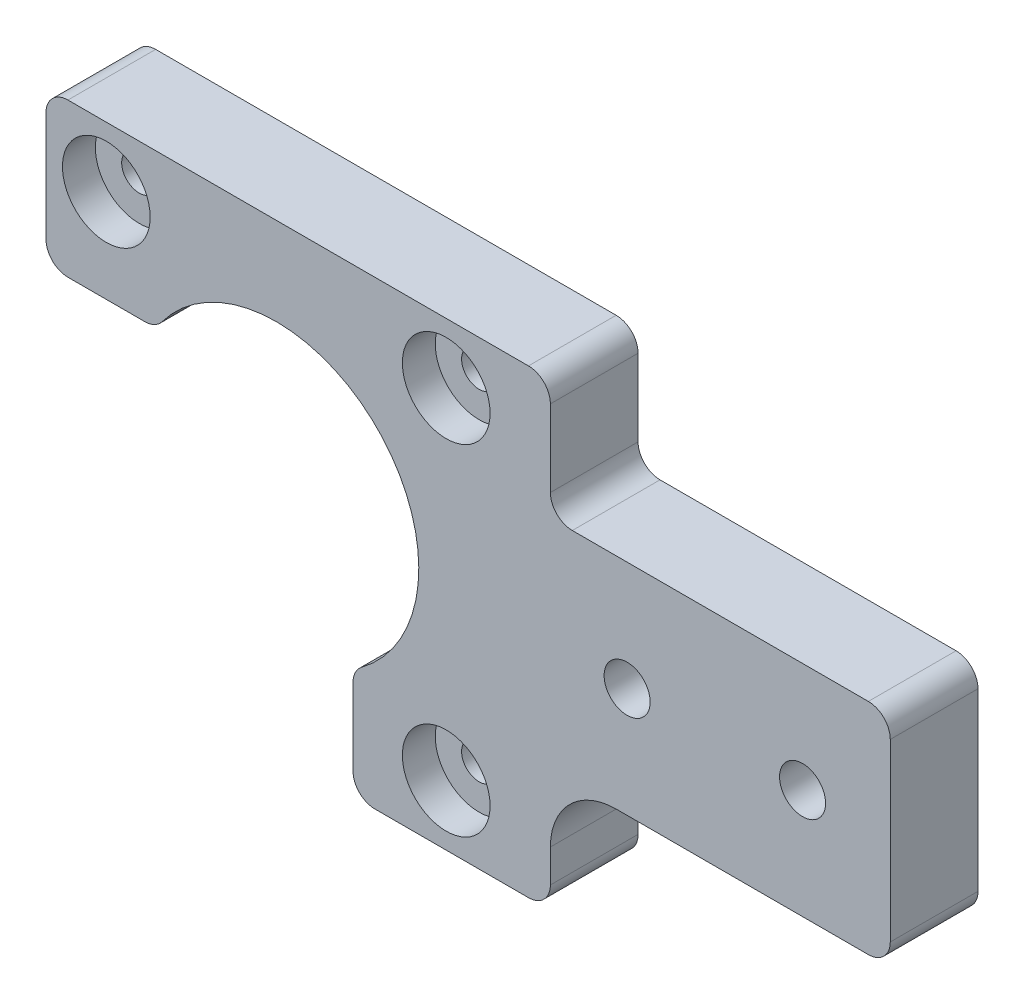
from build123d import *

# Parameters (mm, degrees)
ESQUISSE1_W             = 77
ESQUISSE1_H             = 42
BOSS_EXTRU_1_DEPTH      = 8
ESQUISSE3_R             = 4
ENL_V_MAT_EXTRU_1_DEPTH = 3
ESQUISSE4_R             = 13
ENL_V_MAT_EXTRU_2_DEPTH = 89.073832663
ESQUISSE5_W             = 28
ESQUISSE5_H             = 28
ENL_V_MAT_EXTRU_3_DEPTH = 89.073832663
ESQUISSE10_R            = 1.6
ENL_V_MAT_EXTRU_4_DEPTH = 88.852148522
ESQUISSE11_W            = 31
ESQUISSE11_H            = 11
ENL_V_MAT_EXTRU_5_DEPTH = 89.073832663
ESQUISSE12_R            = 2.1
ENL_V_MAT_EXTRU_6_DEPTH = 89.073832663
CONG_1_R                = 6
CONG_2_R                = 2


with BuildPart() as part:
    # Esquisse1 → Boss.-Extru.1 (new body)
    with BuildSketch(Plane.XY):
        with Locations((38.5, 21)):
            Rectangle(ESQUISSE1_W, ESQUISSE1_H)
    extrude(amount=BOSS_EXTRU_1_DEPTH)

    # Esquisse3 → Enlèv. mat.-Extru.1 (cut)
    with BuildSketch(Plane.XY.offset(8)):
        with Locations((5.5, 36.5)):
            Circle(ESQUISSE3_R)
        with Locations((36.5, 36.5)):
            Circle(ESQUISSE3_R)
        with Locations((36.5, 5.5)):
            Circle(ESQUISSE3_R)
    extrude(amount=-ENL_V_MAT_EXTRU_1_DEPTH, mode=Mode.SUBTRACT)

    # Esquisse4 → Enlèv. mat.-Extru.2 (cut, through all)
    with BuildSketch(Plane.XY.offset(8)):
        with Locations((21, 21)):
            Circle(ESQUISSE4_R)
    extrude(amount=-ENL_V_MAT_EXTRU_2_DEPTH, mode=Mode.SUBTRACT)

    # Esquisse5 → Enlèv. mat.-Extru.3 (cut, through all)
    with BuildSketch(Plane.XY.offset(8)):
        with Locations((14, 14)):
            Rectangle(ESQUISSE5_W, ESQUISSE5_H)
    extrude(amount=-ENL_V_MAT_EXTRU_3_DEPTH, mode=Mode.SUBTRACT)

    # Esquisse10 → Enlèv. mat.-Extru.4 (cut, through all)
    with BuildSketch(Plane.XY.offset(5)):
        with Locations((5.5, 36.5)):
            Circle(ESQUISSE10_R)
        with Locations((36.5, 36.5)):
            Circle(ESQUISSE10_R)
        with Locations((36.5, 5.5)):
            Circle(ESQUISSE10_R)
    extrude(amount=-ENL_V_MAT_EXTRU_4_DEPTH, mode=Mode.SUBTRACT)

    # Esquisse11 → Enlèv. mat.-Extru.5 (cut, through all)
    with BuildSketch(Plane.XY.offset(8)):
        with Locations((61.5, 5.5)):
            Rectangle(ESQUISSE11_W, ESQUISSE11_H)
        with Locations((61.5, 36.5)):
            Rectangle(ESQUISSE11_W, ESQUISSE11_H)
    extrude(amount=-ENL_V_MAT_EXTRU_5_DEPTH, mode=Mode.SUBTRACT)

    # Esquisse12 → Enlèv. mat.-Extru.6 (cut, through all)
    with BuildSketch(Plane.XY.offset(8)):
        with Locations((53, 21)):
            Circle(ESQUISSE12_R)
        with Locations((69, 21)):
            Circle(ESQUISSE12_R)
    extrude(amount=-ENL_V_MAT_EXTRU_6_DEPTH, mode=Mode.SUBTRACT)

    # Congé1
    cong_1_edges = [part.edges().sort_by_distance(p)[0] for p in [
        (46, 11, 4),
    ]]
    fillet(cong_1_edges, radius=CONG_1_R)

    # Congé2
    cong_2_edges = [part.edges().sort_by_distance(p)[0] for p in [
        (28, 10.04554885, 4),
        (0, 42, 4),
        (77, 11, 4),
        (10.04554885, 28, 4),
        (0, 28, 4),
        (28, 0, 4),
        (46, 0, 4),
        (46, 42, 4),
        (46, 31, 4),
        (77, 31, 4),
    ]]
    fillet(cong_2_edges, radius=CONG_2_R)


solid = part.part
